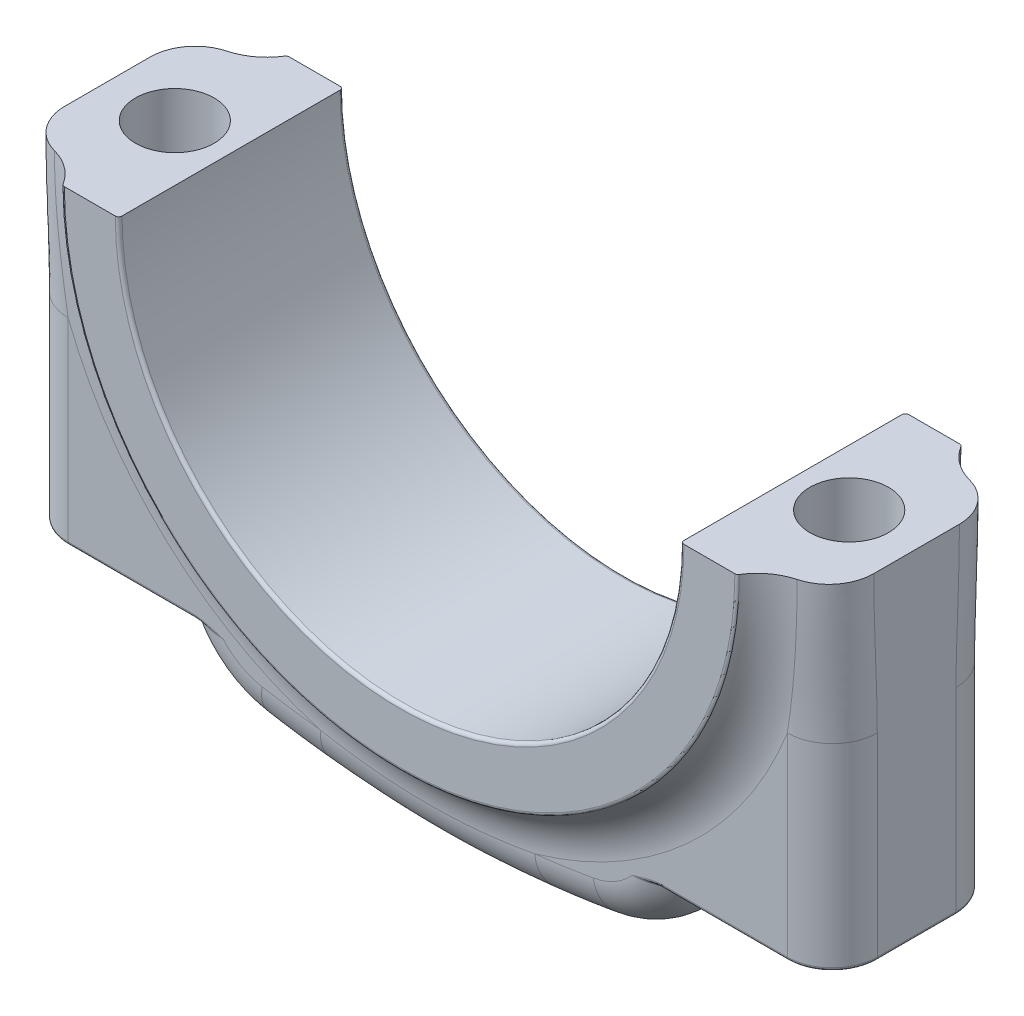
from build123d import *

# Parameters (mm, degrees)
BOSS_EXTRUDE1_DEPTH      = 7.5
BOSS_EXTRUDE2_DEPTH      = 2.5
FILLET1_R                = 5
F_7_0_7_DIAMETER_HOLE1_D = 7
SKETCH6_W                = 13
SKETCH6_H                = 10
CUT_EXTRUDE1_DEPTH       = 48.916594340583124
FILLET2_R                = 10
FILLET3_R                = 4
FILLET4_R                = 0.3


with BuildPart() as part:
    # Sketch1 → Boss-Extrude1 (new body)
    with BuildSketch(Plane.XY):
        with BuildLine():
            Line((0, -25), (0, -37.51363749079488))
            ThreePointArc((0, -37.51363749079488), (18.38786793202979, -35.615205654558174), (36, -30))
            Line((36, -30), (36, 0))
            Line((36, 0), (25, 0))
            ThreePointArc((25, 0), (17.67766952966369, -17.677669529663685), (0, -25))
        make_face()
    extrude(amount=BOSS_EXTRUDE1_DEPTH)

    # Sketch2 → Boss-Extrude2 (add)
    with BuildSketch(Plane.XY.offset(7.5)):
        with BuildLine():
            Line((25, 0), (30, 0))
            ThreePointArc((30, 0), (21.213203435596427, -21.213203435596423), (0, -30))
            Line((0, -30), (0, -25))
            ThreePointArc((0, -25), (17.67766952966369, -17.677669529663685), (25, 0))
        make_face()
    extrude(amount=BOSS_EXTRUDE2_DEPTH)

    # Fillet1
    # the kernel refuses this fillet: 5 mm, written as the material it adds along each edge
    with BuildSketch(Plane(origin=(-8.88e-15, 7.99e-15, 7.5), x_dir=(1, -2.7e-16, 0), z_dir=(2.7e-16, 1, 0))) as fillet1_piece_1:
        with BuildLine():
            CenterArc((34.33012701892245, -5), FILLET1_R, 90, 60.00000000000142)
            Line((30.000000000000192, -2.5000000000001066), (29.91339745962175, -2.4500000000001094))
            ThreePointArc((29.91339745962175, -2.4500000000001094), (29.900000000000006, -1.2500000000000533), (29.900000000000006, 0))
            Line((29.900000000000006, 0), (30.000000000000007, 0.09999999999999964))
            Line((30.000000000000007, 0.09999999999999964), (34.33012701892245, 0.09999999999999964))
            Line((34.33012701892245, 0.09999999999999964), (34.33012701892245, 0))
        make_face()
    revolve(axis=Axis((-8.88e-15, 7.99e-15, 7.5), (0, 0, -1)), revolution_arc=89.99999999999997)

    # Ø7.0 (7) Diameter Hole1 (through all)
    with Locations(Plane(origin=(0, 0, 0), x_dir=(1, 0, 0), z_dir=(0, 1, 0))):
        with Locations((30, 0)):
            Hole(F_7_0_7_DIAMETER_HOLE1_D / 2)

    # Sketch6 → Cut-Extrude1 (cut, through all)
    with BuildSketch(Plane(origin=(0, -30.000000000000014, 0), x_dir=(1, 0, 0), z_dir=(0, 1, 0))):
        with Locations((29.5, -5)):
            Rectangle(SKETCH6_W, SKETCH6_H)
    extrude(amount=-CUT_EXTRUDE1_DEPTH, mode=Mode.SUBTRACT)

    # Fillet2
    # the kernel refuses this fillet: 10 mm, written as the material it takes off along each edge
    with BuildSketch(Plane(origin=(23, -34.525130984470756, 26.925869482875026), x_dir=(-7.85e-15, 1, 0), z_dir=(0, 0, -1))) as fillet2_piece_1:
        with BuildLine():
            CenterArc((8.19273684798337, -9.303153617452946), FILLET2_R, 111.51597242857102, 58.625815395979885)
            Line((-1.6596077327282162, -7.591047819634649), (-1.8566546243424444, -7.5568057036782825))
            ThreePointArc((-1.8566546243424444, -7.5568057036782825), (-1.1071508139387296, -3.734888388901121), (-0.19335887443038796, 0.05111111111111048))
            Line((-0.19335887443038796, 0.05111111111111048), (-1.57e-15, 0.1999999999999993))
            ThreePointArc((-1.57e-15, 0.1999999999999993), (2.262565492235373, 0.20000000000001705), (4.451778867200504, 0.18606307234906025))
            Line((4.451778867200504, 0.18606307234906025), (4.525130984470756, 0))
        make_face()
    extrude(amount=46.35173896575005, mode=Mode.SUBTRACT)

    # Fillet3
    fillet3_edges = [part.edges().sort_by_distance(p)[0] for p in [
        (20.013232473219052, -34.085023803482585, 7.5),
        (7.733074732072455, -37.18079733869116, 7.5),
        (36, -15, 7.5),
    ]]
    fillet(fillet3_edges, radius=FILLET3_R)

    # Fillet4
    fillet4_edges = [part.edges().sort_by_distance(p)[0] for p in [
        (21.21320343559642, -21.213203435596427, 10),
    ]]
    fillet(fillet4_edges, radius=FILLET4_R)
    fillet4_2_edges = [part.edges().sort_by_distance(p)[0] for p in [
        (17.67766952966368, -17.67766952966369, 10),
    ]]
    fillet(fillet4_2_edges, radius=FILLET4_R)
    fillet4_3_edges = [part.edges().sort_by_distance(p)[0] for p in [
        (21.591435728426237, -30.000000000000014, 6.446749507299309),
        (23, -30.000000000000014, 1.7500000000000004),
    ]]
    fillet(fillet4_3_edges, radius=FILLET4_R)
    fillet4_4_edges = [part.edges().sort_by_distance(p)[0] for p in [
        (26.07646993001418, -30.000000000000014, 7.5),
        (34.82842712474247, -30.000000000000014, 6.328427124749906),
        (36, -30.000000000000004, 1.75),
    ]]
    fillet(fillet4_4_edges, radius=FILLET4_R)

    # Mirror1: part across plane


with BuildPart() as part_1:
    add(part.part)
    add(part.part.mirror(Plane(origin=(0, 0, 0), x_dir=(0, 0, 1), z_dir=(1, 0, 0))))

    # Mirror2: part across plane


with BuildPart() as part_2:
    add(part_1.part)
    add(part_1.part.mirror(Plane.XY))


solid = part_2.part
